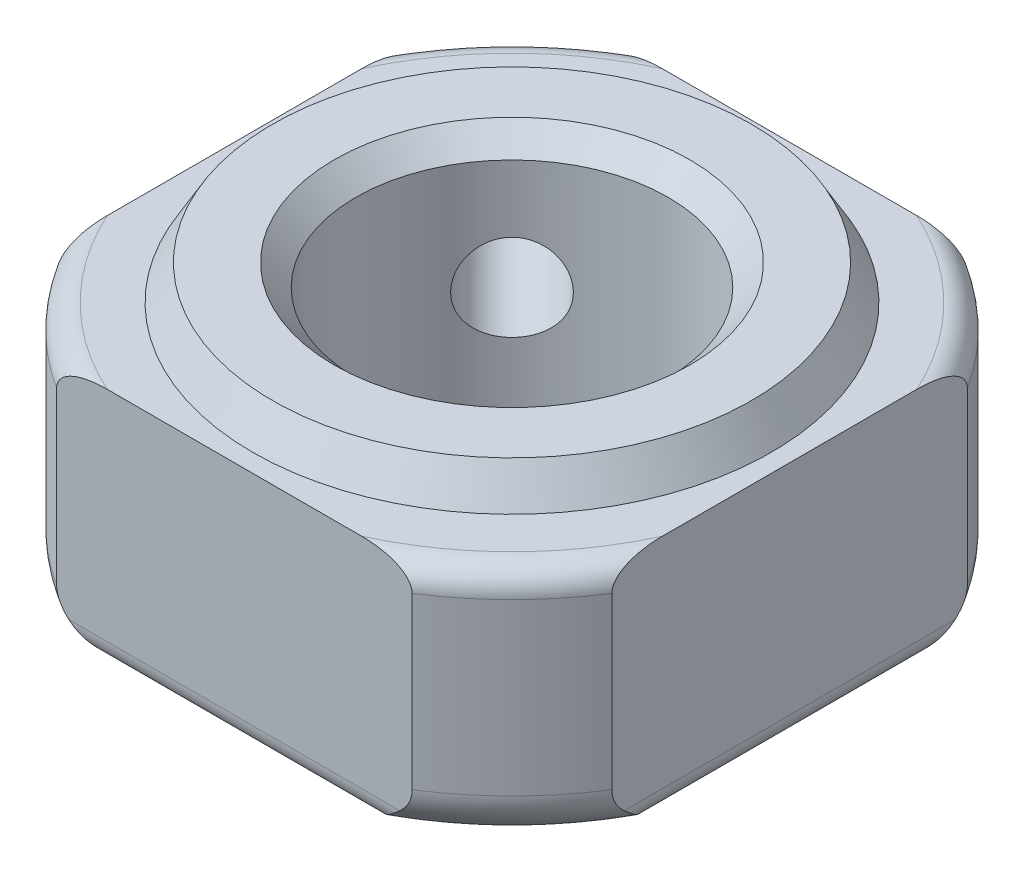
from build123d import *

# Parameters (mm, degrees)
BOSS_EXTRUDE1_DEPTH = 8
FILLET2_R           = 1.4
FILLET3_R           = 0.7


with BuildPart() as part:
    # Sketch1 → Boss-Extrude1 (new body)
    with BuildSketch(Plane(origin=(0, 0, 0), x_dir=(1, 0, 0), z_dir=(0, 1, 0))):
        with BuildLine():
            Line((-8, 5.123475383), (-8, -5.123475383))
            ThreePointArc((-8, -5.123475383), (-6.717514421, -6.717514421), (-5.123475383, -8))
            Line((-5.123475383, -8), (5.123475383, -8))
            ThreePointArc((5.123475383, -8), (6.717514421, -6.717514421), (8, -5.123475383))
            Line((8, -5.123475383), (8, 5.123475383))
            ThreePointArc((8, 5.123475383), (6.717514421, 6.717514421), (5.123475383, 8))
            Line((5.123475383, 8), (-5.123475383, 8))
            ThreePointArc((-5.123475383, 8), (-6.717514421, 6.717514421), (-8, 5.123475383))
        make_face()
    extrude(amount=BOSS_EXTRUDE1_DEPTH)

    # Sketch2 → Cut-Revolve1 (revolve, cut)
    with BuildSketch(Plane.XY, mode=Mode.PRIVATE) as cut_revolve1_sk:
        Polygon((6.9, 8), (7.477350269, 7), (9.756701135, 7), (9.756701135, 8), align=None)
    revolve(cut_revolve1_sk.sketch.rotate(Axis((0, 0, 0), (0, 1, 0)), 90), axis=Axis((0, 0, 0), (0, 1, 0)), mode=Mode.SUBTRACT)

    # Sketch5 → M10x1.0 Tapped Hole1 (revolve, cut)
    with BuildSketch(Plane(origin=(0, 0, 0), x_dir=(0, 0, -1), z_dir=(1, 0, 0))):
        Polygon((0, 0), (0, 8), (5.125, 8), (4.5, 7.375), (4.5, 0.625), (5.125, 0), align=None)
    revolve(axis=Axis((0, -6.35, 0), (0, 1, 0)), mode=Mode.SUBTRACT)

    # M3 Tapped Hole1: read off the stored shape, not the designer's step
    # M3 Tapped Hole1 outline → M3 Tapped Hole1 (revolve, cut)
    with BuildSketch(Plane(origin=(0, 4.19513424, 0), x_dir=(0.7071067811865471, 0, -0.707106781186548), z_dir=(0, -1, 0))):
        Polygon((0, -9.500060785), (1.525060785, -9.500060785), (1.25, -9.225), (1.25, -4.322803032), (0, -4.322803032), align=None)
    revolve(axis=Axis((0, 4.19513424, 0), (0.707106781186548, 0, 0.7071067811865471)), mode=Mode.SUBTRACT)

    # Fillet2
    fillet2_edges = [part.edges().sort_by_distance(p)[0] for p in [
        (6.717514421, 0, 6.717514421),
        (-6.717514421, 0, 6.717514421),
        (-6.717514421, 0, -6.717514421),
        (6.717514421, 0, -6.717514421),
    ]]
    fillet(fillet2_edges, radius=FILLET2_R)

    # Fillet3
    # the kernel refuses this fillet: 0.7 mm, written as the material it takes off along each edge
    with BuildSketch(Plane(origin=(0, 7, 0), x_dir=(-0.3759346527851674, 0, 0.9266461767229688), z_dir=(0.9266461767229688, 0, 0.3759346527851674))) as fillet3_piece_1:
        with BuildLine():
            CenterArc((9.5 - FILLET3_R, FILLET3_R), FILLET3_R, 270, 90)
            Line((9.5, FILLET3_R), (9.5, 0))
            Line((9.5, 0), (9.5 - FILLET3_R, 0))
        make_face()
    revolve(axis=Axis((0, 7, 0), (0, -1, 0)), revolution_arc=45.835816267, mode=Mode.SUBTRACT)
    with BuildSketch(Plane(origin=(0, 7, 0), x_dir=(-0.9266461767229688, 0, -0.3759346527851675), z_dir=(-0.3759346527851675, 0, 0.9266461767229688))) as fillet3_piece_2:
        with BuildLine():
            CenterArc((9.5 - FILLET3_R, FILLET3_R), FILLET3_R, 270, 90)
            Line((9.5 - FILLET3_R, 0), (9.5, 0))
            Line((9.5, 0), (9.5, FILLET3_R))
        make_face()
    revolve(axis=Axis((0, 7, 0), (0, -1, 0)), revolution_arc=45.835816267, mode=Mode.SUBTRACT)
    with BuildSketch(Plane(origin=(0, 7, 0), x_dir=(0.3759346527851687, 0, -0.9266461767229682), z_dir=(-0.9266461767229682, 0, -0.3759346527851687))) as fillet3_piece_3:
        with BuildLine():
            CenterArc((9.5 - FILLET3_R, FILLET3_R), FILLET3_R, 270, 90)
            Line((9.5 - FILLET3_R, 0), (9.5, 0))
            Line((9.5, 0), (9.5, FILLET3_R))
        make_face()
    revolve(axis=Axis((0, 7, 0), (0, -1, 0)), revolution_arc=45.835816267, mode=Mode.SUBTRACT)
    with BuildSketch(Plane(origin=(0, 7, 0), x_dir=(0.9266461767229706, 0, 0.3759346527851629), z_dir=(0.3759346527851629, 0, -0.9266461767229706))) as fillet3_piece_4:
        with BuildLine():
            CenterArc((9.5 - FILLET3_R, FILLET3_R), FILLET3_R, 270, 90)
            Line((9.5, FILLET3_R), (9.5, 0))
            Line((9.5, 0), (9.5 - FILLET3_R, 0))
        make_face()
    revolve(axis=Axis((0, 7, 0), (0, -1, 0)), revolution_arc=45.835816267, mode=Mode.SUBTRACT)
    with BuildSketch(Plane(origin=(8, 0, 6.518857754), x_dir=(-1, 0, 0), z_dir=(0, 0, -1)), Plane(origin=(-6.518857754, 0, 8), x_dir=(0, 0, -1), z_dir=(1, 0, 0)), Plane(origin=(-8, 0, -6.518857754), x_dir=(1, 0, 0), z_dir=(0, 0, 1))) as fillet3_piece_5:
        with BuildLine():
            CenterArc((FILLET3_R, FILLET3_R), FILLET3_R, 180, 90)
            Line((0, FILLET3_R), (0, 0))
            Line((0, 0), (FILLET3_R, 0))
        make_face()
    extrude(amount=13.037715508, mode=Mode.SUBTRACT)
    with BuildSketch(Plane(origin=(6.518857754, 0, -8), x_dir=(0, 1, 0), z_dir=(-1, 0, 0))) as fillet3_piece_6:
        with BuildLine():
            CenterArc((FILLET3_R, -FILLET3_R), FILLET3_R, 90, 90)
            Line((0, -FILLET3_R), (0, 0))
            Line((0, 0), (FILLET3_R, 0))
        make_face()
    extrude(amount=13.037715508, mode=Mode.SUBTRACT)


solid = part.part
